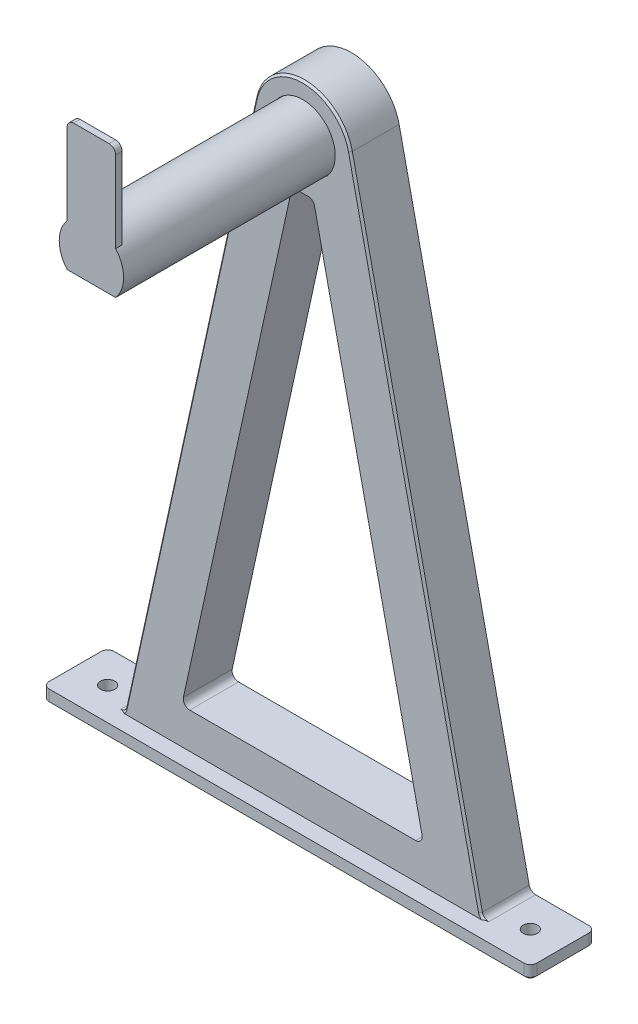
from build123d import *

# Parameters (mm, degrees)
BOSS_EXTRUDE1_DEPTH = 20
SKETCH2_W           = 110
SKETCH2_H           = 232.935125723
CUT_EXTRUDE1_DEPTH  = 5
BOSS_EXTRUDE2_DEPTH = 80
SKETCH3_W           = 14.909443404
SKETCH3_H           = 40
BOSS_EXTRUDE3_DEPTH = 2
SKETCH4_R           = 2.2
CUT_EXTRUDE2_DEPTH  = 4
FILLET1_R           = 2
CHAMFER1_SIZE       = 0.6
CHAMFER2_SIZE       = 1
FILLET2_R           = 2
CHAMFER3_SIZE       = 0.6


with BuildPart() as part:
    # Sketch1 → Boss-Extrude1 (new body)
    with BuildSketch(Plane.XY):
        with BuildLine():
            Line((-60.347356399, 188.20936684), (-20, 4))
            Line((-20, 4), (0, 4))
            Line((0, 4), (0, 0))
            Line((0, 0), (-150, 0))
            Line((-150, 0), (-150, 4))
            Line((-150, 4), (-130, 4))
            Line((-130, 4), (-89.652643601, 188.20936684))
            ThreePointArc((-89.652643601, 188.20936684), (-75, 200), (-60.347356399, 188.20936684))
        make_face()
        with BuildLine():
            Line((-112.235080417, 15), (-78.20936684, 170.347356399))
            ThreePointArc((-78.20936684, 170.347356399), (-75, 170), (-71.79063316, 170.347356399))
            Line((-71.79063316, 170.347356399), (-37.764919583, 15))
            Line((-37.764919583, 15), (-112.235080417, 15))
        make_face(mode=Mode.SUBTRACT)
        with BuildLine():
            ThreePointArc((-67.5, 178.385621722), (-75, 195), (-82.5, 178.385621722))
            Line((-82.5, 178.385621722), (-67.5, 178.385621722))
        make_face(mode=Mode.SUBTRACT)
    extrude(amount=BOSS_EXTRUDE1_DEPTH)

    # Sketch2 → Cut-Extrude1 (cut)
    with BuildSketch(Plane.XY.offset(20)):
        with Locations((-75, 120.467562862)):
            Rectangle(SKETCH2_W, SKETCH2_H)
    extrude(amount=-CUT_EXTRUDE1_DEPTH, mode=Mode.SUBTRACT)

    # Sketch4 → Cut-Extrude2 (cut)
    with BuildSketch(Plane(origin=(0, 4, 0), x_dir=(1, 0, 0), z_dir=(0, 1, 0))):
        with Locations(Location((-140, -10, 0), (0, 0, 180))):
            Circle(SKETCH4_R)
        with Locations(Location((-10, -10, 0), (0, 0, 180))):
            Circle(SKETCH4_R)
    extrude(amount=-CUT_EXTRUDE2_DEPTH, mode=Mode.SUBTRACT)

    # Fillet1
    fillet1_edges = [part.edges().sort_by_distance(p)[0] for p in [
        (0, 2, 0),
        (-150, 2, 0),
        (-20, 4, 7.5),
        (-112.235080417, 15, 7.5),
        (-37.764919583, 15, 7.5),
        (-71.79063316, 170.347356399, 7.5),
        (-78.20936684, 170.347356399, 7.5),
        (-130, 4, 7.5),
        (-150, 2, 20),
        (0, 2, 20),
    ]]
    fillet(fillet1_edges, radius=FILLET1_R)

    # Chamfer1
    chamfer1_edges = [part.edges().sort_by_distance(p)[0] for p in [
        (0, 0, 10),
        (-75, 0, 0),
        (-75, 0, 20),
        (-150, 0, 10),
        (-149.414213562, 0, 0.585786438),
        (-149.414213562, 0, 19.414213562),
        (-0.585786438, 0, 19.414213562),
        (-0.585786438, 0, 0.585786438),
        (-137.8, 0, 10),
        (-7.8, 0, 10),
    ]]
    chamfer(chamfer1_edges, length=CHAMFER1_SIZE)

    # Chamfer3
    # the kernel refuses this chamfer: 0.6 mm, written as the material it takes off along each edge
    with BuildSketch(Plane(origin=(-18.390647656, 6, 15), x_dir=(-0.976842906707418, -0.21395778933098608, 0), z_dir=(-0.21395778933098608, 0.976842906707418, 0))) as chamfer3_piece_1_section:
        Polygon((2, -CHAMFER3_SIZE), (2 + CHAMFER3_SIZE, 0), (2, 0), align=None)
    chamfer3_piece_1 = revolve(axis=Axis((-18.390647656, 6, 15), (0, 0, 1)), revolution_arc=121.862799831, mode=Mode.PRIVATE)
    chamfer3_piece_1 = split(chamfer3_piece_1, bisect_by=Plane(origin=(-19.694656752, 4, 14.765716597), z_dir=(0, 1, 0)), keep=Keep.TOP, mode=Mode.PRIVATE)
    add(chamfer3_piece_1, mode=Mode.SUBTRACT)
    with BuildSketch(Plane(origin=(-131.609352344, 6, 15), x_dir=(-0.697380161967856, -0.716701409021698, 0), z_dir=(-0.716701409021698, 0.697380161967856, 0))) as chamfer3_piece_2_section:
        Polygon((2 + CHAMFER3_SIZE, 0), (2, -CHAMFER3_SIZE), (2, 0), align=None)
    chamfer3_piece_2 = revolve(axis=Axis((-131.609352344, 6, 15), (0, 0, 1)), revolution_arc=121.862799831, mode=Mode.PRIVATE)
    chamfer3_piece_2 = split(chamfer3_piece_2, bisect_by=Plane(origin=(-130.305343248, 4, 14.765716597), z_dir=(0, 1, 0)), keep=Keep.TOP, mode=Mode.PRIVATE)
    add(chamfer3_piece_2, mode=Mode.SUBTRACT)
    with BuildSketch(Plane(origin=(-129.65566653, 5.572084421, 15), x_dir=(0.9764735789240729, -0.21387689550914105, 0.02749587661058188), z_dir=(0.21395778933098342, 0.9768429067074187, 0)), Plane(origin=(-60.347356399, 188.20936684, 15), x_dir=(-0.9764735789240728, -0.21387689550914124, 0.027495876610587368), z_dir=(0.21395778933098364, -0.9768429067074186, 0))) as chamfer3_piece_3:
        Polygon((CHAMFER3_SIZE * 0.999621916911, CHAMFER3_SIZE * 0.0274958766106), (-CHAMFER3_SIZE * 0.0274958766106, CHAMFER3_SIZE * 0.999621916911), (0, 0), align=None)
    extrude(amount=186.966892184, mode=Mode.SUBTRACT)
    with BuildSketch(Plane(origin=(-75, 185, 15), x_dir=(-0.9768429067074185, 0.213957789330984, 0), z_dir=(-0.213957789330984, -0.9768429067074185, 0))) as chamfer3_piece_4:
        Polygon((15 - CHAMFER3_SIZE, 0), (15, CHAMFER3_SIZE), (15, 0), align=None)
    revolve(axis=Axis((-75, 185, 15), (0, 0, -1)), revolution_arc=155.291219427, mode=Mode.SUBTRACT)


with BuildPart() as body_2:
    # Sketch1<3> → Boss-Extrude2 (new body)
    with BuildSketch(Plane.XY):
        with BuildLine():
            Line((-82.454721702, 178.485621722), (-67.545278298, 178.485621722))
            ThreePointArc((-67.545278298, 178.485621722), (-75, 194.9), (-82.454721702, 178.485621722))
        make_face()
    extrude(amount=BOSS_EXTRUDE2_DEPTH)

    # Sketch3 → Boss-Extrude3 (add)
    with BuildSketch(Plane.XY.offset(80)):
        with Locations((-75, 198.485621722)):
            Rectangle(SKETCH3_W, SKETCH3_H)
    extrude(amount=-BOSS_EXTRUDE3_DEPTH)

    # Chamfer2
    chamfer2_edges = [body_2.edges().sort_by_distance(p)[0] for p in [
        (-75, 194.9, 0),
        (-75, 178.485621722, 0),
    ]]
    chamfer(chamfer2_edges, length=CHAMFER2_SIZE)

    # Fillet2
    fillet2_edges = [body_2.edges().sort_by_distance(p)[0] for p in [
        (-67.545278298, 218.485621722, 79),
        (-82.454721702, 218.485621722, 79),
    ]]
    fillet(fillet2_edges, radius=FILLET2_R)


solid = Compound([part.part, body_2.part])
